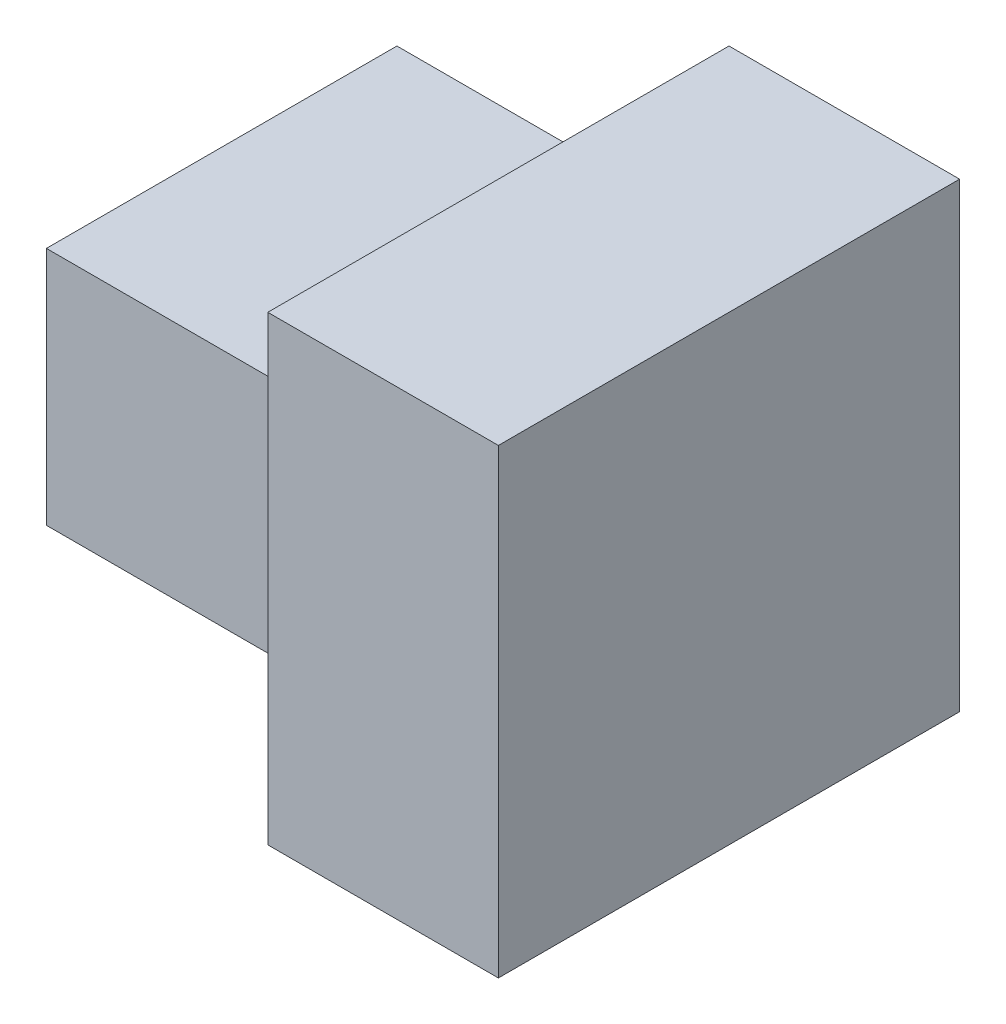
from build123d import *

# Parameters (mm, degrees)
BOSS_EXTRUDE1_DEPTH = 5
BOSS_EXTRUDE2_DEPTH = 5
CHAMFER1_SIZE       = 0.3
CHAMFER2_SIZE       = 0.2
BOSS_EXTRUDE3_DEPTH = 1
BOSS_EXTRUDE4_DEPTH = 0.6
CHAMFER4_SIZE       = 0.2
SKETCH5_W           = 10
SKETCH5_H           = 10
BOSS_EXTRUDE5_DEPTH = 5
FILLET1_R           = 0.5


with BuildPart() as part:
    # Sketch1 → Boss-Extrude1 (new body)
    with BuildSketch(Plane(origin=(0, 0, 0), x_dir=(0, 0, -1), z_dir=(1, 0, 0))):
        with BuildLine():
            Line((-2.2, 1), (2.2, 1))
            ThreePointArc((2.2, 1), (2.412132034, 0.912132034), (2.5, 0.7))
            Line((2.5, 0.7), (2.5, -0.7))
            ThreePointArc((2.5, -0.7), (2.412132034, -0.912132034), (2.2, -1))
            Line((2.2, -1), (-2.2, -1))
            ThreePointArc((-2.2, -1), (-2.412132034, -0.912132034), (-2.5, -0.7))
            Line((-2.5, -0.7), (-2.5, 0.7))
            ThreePointArc((-2.5, 0.7), (-2.412132034, 0.912132034), (-2.2, 1))
        make_face()
    extrude(amount=BOSS_EXTRUDE1_DEPTH)

    # Chamfer1
    chamfer1_edges = [part.edges().sort_by_distance(p)[0] for p in [
        (0, -1, 0),
        (0, -0.912132034, 2.412132034),
        (0, 0, 2.5),
        (0, 0.912132034, 2.412132034),
        (0, 1, 0),
        (0, 0.912132034, -2.412132034),
        (0, 0, -2.5),
        (0, -0.912132034, -2.412132034),
    ]]
    chamfer(chamfer1_edges, length=CHAMFER1_SIZE - 0.0001)  # a hair under: the kernel refuses the full size



with BuildPart() as body_2:
    # Sketch2 → Boss-Extrude2 (new body)
    with BuildSketch(Plane.ZY):
        Polygon((3.8, -2.1), (2.8, -3.1), (-2.8, -3.1), (-3.8, -2.1), (-3.8, 3.1), (3.8, 3.1), align=None)
        Polygon((3.5, 2.8), (-3.5, 2.8), (-3.5, -1.8), (-2.5, -2.8), (2.5, -2.8), (3.5, -1.8), align=None, mode=Mode.SUBTRACT)
    extrude(amount=-BOSS_EXTRUDE2_DEPTH)

    # Chamfer2
    chamfer2_edges = [body_2.edges().sort_by_distance(p)[0] for p in [
        (0, 0.5, 3.5),
        (0, 2.8, 0),
        (0, 0.5, -3.5),
        (0, -2.3, -3),
        (0, -2.8, 0),
        (0, -2.3, 3),
    ]]
    chamfer(chamfer2_edges, length=CHAMFER2_SIZE)


with BuildPart() as part_1:
    add(part.part)

    add(body_2.part)  # Boss-Extrude3 merges body 2
    # Sketch3 → Boss-Extrude3 (add)
    with BuildSketch(Plane(origin=(5, 0, 0), x_dir=(0, 0, -1), z_dir=(1, 0, 0))):
        Polygon((-3.8, -2.1), (-2.8, -3.1), (2.8, -3.1), (3.8, -2.1), (3.8, 3.1), (-3.8, 3.1), align=None)
    extrude(amount=BOSS_EXTRUDE3_DEPTH)

    # Sketch4 → Boss-Extrude4 (add)
    with BuildSketch(Plane.XZ.offset(3.1)):
        with BuildLine():
            Line((1, 0.8), (1, -0.8))
            ThreePointArc((1, -0.8), (1.527586443, -1.327586443), (2.055172886, -0.8))
            Line((2.055172886, -0.8), (2.055172886, 0.8))
            ThreePointArc((2.055172886, 0.8), (1.527586443, 1.327586443), (1, 0.8))
        make_face()
    extrude(amount=-BOSS_EXTRUDE4_DEPTH)

    # Chamfer4
    chamfer4_edges = [part_1.edges().sort_by_distance(p)[0] for p in [
        (1.527586443, -2.5, 1.327586443),
        (2.055172886, -2.5, 0),
        (1.527586443, -2.5, -1.327586443),
        (1, -2.5, 0),
    ]]
    chamfer(chamfer4_edges, length=CHAMFER4_SIZE)

    # Sketch5 → Boss-Extrude5 (add)
    with BuildSketch(Plane(origin=(6, 0, 0), x_dir=(0, 0, -1), z_dir=(1, 0, 0))):
        with Locations((0, 0.5)):
            Rectangle(SKETCH5_W, SKETCH5_H)
    extrude(amount=BOSS_EXTRUDE5_DEPTH)

    # Fillet1
    fillet1_edges = [part_1.edges().sort_by_distance(p)[0] for p in [
        (6, 0.5, 3.8),
        (6, -2.6, 3.3),
        (6, -3.1, 0),
        (6, -2.6, -3.3),
        (6, 0.5, -3.8),
        (6, 3.1, 0),
    ]]
    fillet(fillet1_edges, radius=FILLET1_R)


solid = part_1.part
